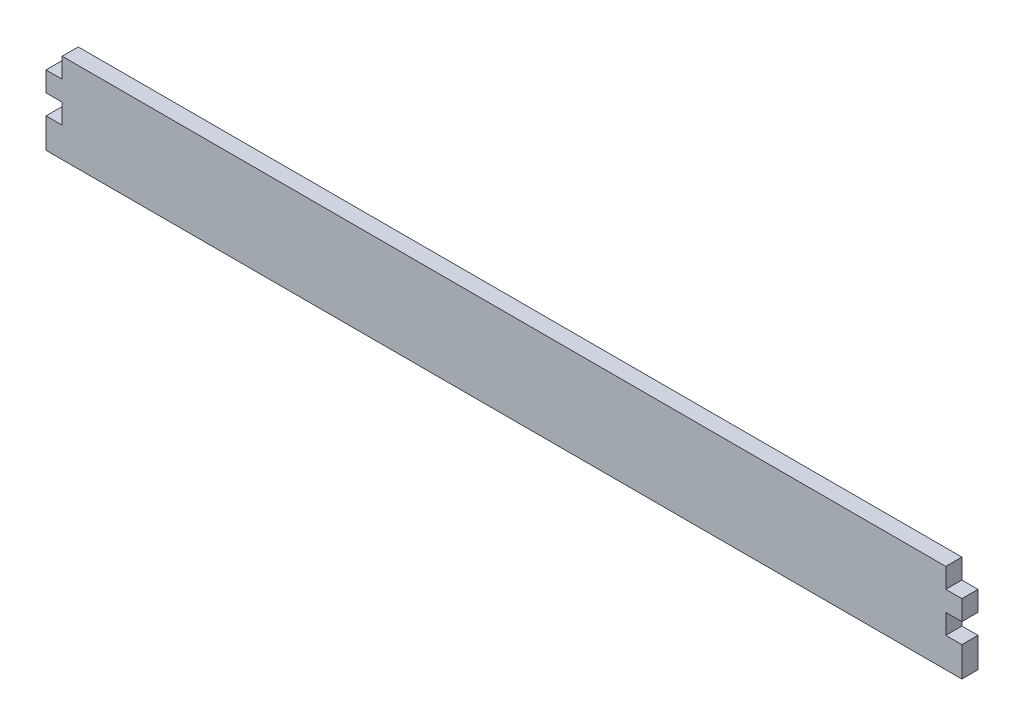
from build123d import *

# Parameters (mm, degrees)
BOSS_EXTRUDE1_DEPTH = 2.7


with BuildPart() as part:
    # Sketch1 → Boss-Extrude1 (new body)
    with BuildSketch(Plane.XY):
        Polygon((-76.7, -1.666666667), (-76.7, 1.666666667), (-74, 1.666666667), (-74, 5), (74, 5), (74, 1.666666667), (76.7, 1.666666667), (76.7, -1.666666667), (74, -1.666666667), (74, -5), (76.7, -5), (76.7, -10), (-76.7, -10), (-76.7, -5), (-74, -5), (-74, -1.666666667), align=None)
    extrude(amount=BOSS_EXTRUDE1_DEPTH)


solid = part.part
